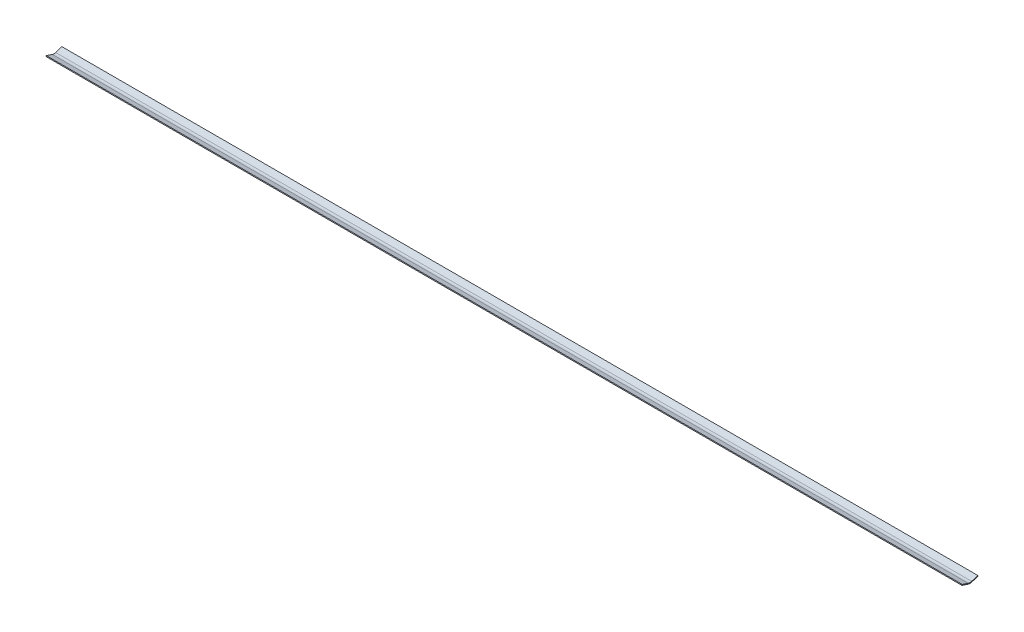
from build123d import *

# Parameters (mm, degrees)
BASE_FLANGE1_DEPTH = 1140


# Sheet-metal steps are written as plain solids
with BuildPart() as part:
    # Sketch1 → Base-Flange1 (new, symmetric)
    with BuildSketch(Plane(origin=(0, 0, 0), x_dir=(0, 0, -1), z_dir=(1, 0, 0))):
        with BuildLine():
            Line((-20, 6.825396825), (-4.844696692, 1.653348871))
            ThreePointArc((-4.844696692, 1.653348871), (0, 0.849436852), (4.844696692, 1.653348871))
            Line((4.844696692, 1.653348871), (20, 6.825396825))
            Line((20, 6.825396825), (19.354040441, 8.718208556))
            Line((19.354040441, 8.718208556), (4.198737133, 3.546160602))
            ThreePointArc((4.198737133, 3.546160602), (0, 2.849436852), (-4.198737133, 3.546160602))
            Line((-4.198737133, 3.546160602), (-19.354040441, 8.718208556))
            Line((-19.354040441, 8.718208556), (-20, 6.825396825))
        make_face()
    extrude(amount=BASE_FLANGE1_DEPTH, both=True)


solid = part.part
